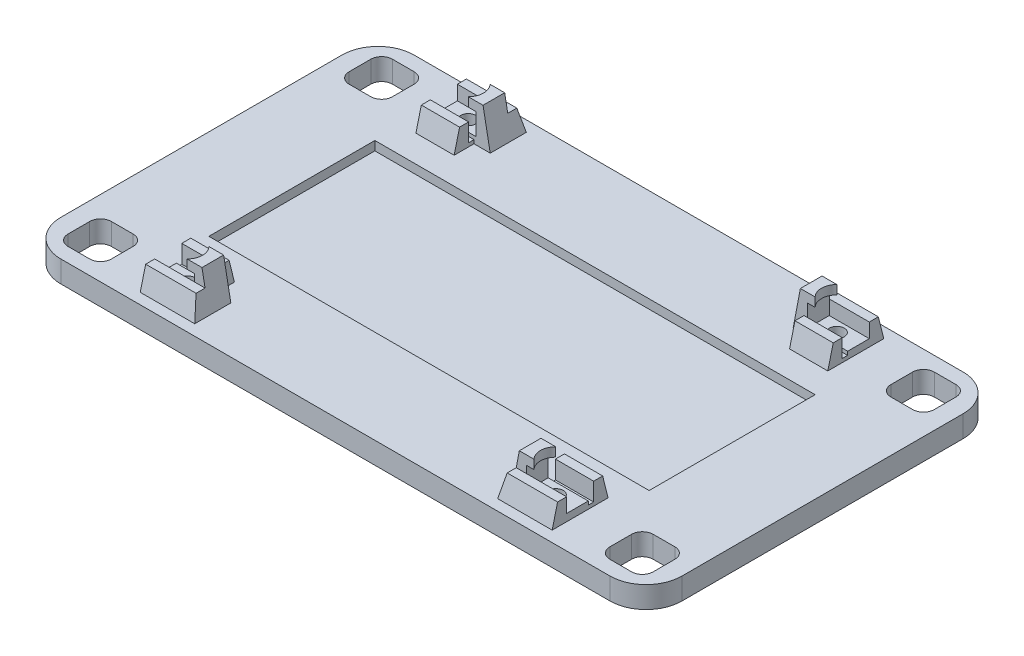
from build123d import *

# Parameters (mm, degrees)
SKETCH1_W                        = 34.5
SKETCH1_H                        = 8.741142107
BOSS_EXTRUDE3_DEPTH              = 6
SKETCH6_W                        = 11
SKETCH6_H                        = 11
BOSS_EXTRUDE4_DEPTH              = 2
CUT_EXTRUDE1_START               = -3
CUT_EXTRUDE1_DEPTH               = 24
SKETCH7_W                        = 11
SKETCH7_H                        = 2.5
SKETCH7_H_2                      = 1
BOSS_EXTRUDE5_DEPTH              = 4
SKETCH10_W                       = 3.083691557
SKETCH10_H                       = 13.597950321
CUT_EXTRUDE2_DEPTH               = 12
SKETCH11_W                       = 10.179154034
SKETCH11_H                       = 1.5
BOSS_EXTRUDE7_DEPTH              = 6
SKETCH12_W                       = 2.5
SKETCH12_H                       = 12.5
BOSS_EXTRUDE8_DEPTH              = 6
BOSS_EXTRUDE9_DEPTH              = 11.6
SKETCH21_R                       = 4.5
CUT_EXTRUDE9_DEPTH               = 3
CUT_EXTRUDE11_DEPTH              = 11.5
BOSS_EXTRUDE14_DEPTH             = 6
CUT_EXTRUDE12_START              = -1
SKETCH28_W                       = 13.111544153
SKETCH28_H                       = 1.5
CUT_EXTRUDE12_DEPTH              = 11
BOSS_EXTRUDE15_DEPTH             = 1.5
SKETCH30_W                       = 2.5
SKETCH30_H                       = 6
BOSS_EXTRUDE16_DEPTH             = 2
SKETCH31_W                       = 2.5
SKETCH31_H                       = 6
BOSS_EXTRUDE17_DEPTH             = 2.5
BOSS_EXTRUDE18_REACH             = 128.051
BOSS_EXTRUDE18_DIRECTION_2_REACH = 128.051
SKETCH34_W                       = 17.603907028
SKETCH34_H                       = 5.411961877
SKETCH34_H_2                     = 6.558600434
CUT_EXTRUDE13_DEPTH              = 4.5
BOSS_EXTRUDE20_DEPTH             = 11.6
MIRROR11_OUTLINE_R               = 2.069860115
MIRROR11_DEPTH                   = 6
MIRROR11_2_OUTLINE_R             = 4.5
MIRROR11_2_OUTLINE_R_2           = 2.069860115
MIRROR11_2_DEPTH                 = 3
MIRROR11_START                   = 6
MIRROR11_3_OUTLINE_R             = 2.069860115
MIRROR11_3_DEPTH                 = 2
MIRROR11_START_2                 = 8
MIRROR11_4_DEPTH                 = 4
MIRROR11_5_OUTLINE_W             = 13.1
MIRROR11_5_OUTLINE_H             = 1.5
MIRROR11_5_DEPTH                 = 1
MIRROR11_START_3                 = 14
MIRROR11_6_DEPTH                 = 2.5
MIRROR11_START_4                 = -59.844904725
MIRROR11_7_OUTLINE_W             = 6
MIRROR11_7_OUTLINE_H             = 2.5
MIRROR11_7_DEPTH                 = 15.1
MIRROR11_START_5                 = -49.244904725
MIRROR11_8_OUTLINE_W             = 10.5
MIRROR11_8_OUTLINE_H             = 6
MIRROR11_8_DEPTH                 = 4.5
MIRROR11_START_6                 = -46.744904725
MIRROR11_9_OUTLINE_W             = 6
MIRROR11_9_OUTLINE_H             = 1.5
MIRROR11_9_DEPTH                 = 2
MIRROR11_10_DEPTH                = 1.5
MIRROR11_START_7                 = -42.831972915
MIRROR11_11_DEPTH                = 2.831972915
BOSS_EXTRUDE21_DEPTH             = 11.6
CUT_EXTRUDE14_START              = -5
SKETCH37_W                       = 89.881860183
SKETCH37_H                       = 1.5
SKETCH37_W_2                     = 87.938782422
CUT_EXTRUDE14_DEPTH              = 5
SKETCH39_W                       = 7.636808492
SKETCH39_H                       = 7.005250269
CUT_EXTRUDE18_DEPTH              = 6
MIRROR13_COPY_1_SKETCH_W         = 7.636808492
MIRROR13_COPY_1_SKETCH_H         = 7.005250269
MIRROR13_COPY_1_DEPTH            = 6
SKETCH41_W                       = 6
SKETCH41_H                       = 6
CUT_EXTRUDE20_DEPTH              = 0.5
SKETCH42_W                       = 122
SKETCH42_H                       = 46
CUT_EXTRUDE21_DEPTH              = 1
SKETCH43_W                       = 24
SKETCH43_H                       = 2
BOSS_EXTRUDE23_DEPTH             = 1
SKETCH44_W                       = 4
SKETCH44_H                       = 17
CUT_EXTRUDE22_DEPTH              = 1.5
SKETCH45_W                       = 16
SKETCH45_H                       = 17
CUT_EXTRUDE23_DEPTH              = 1
SKETCH46_W                       = 58
SKETCH46_H                       = 37
SKETCH46_W_2                     = 54
SKETCH46_H_2                     = 33
BOSS_EXTRUDE25_DEPTH             = 1
SKETCH47_W                       = 54
SKETCH47_H                       = 12
CUT_EXTRUDE24_DEPTH              = 1.5
SKETCH48_W                       = 4
SKETCH48_H                       = 17
CUT_EXTRUDE25_DEPTH              = 1.5
SKETCH49_W                       = 4
SKETCH49_H                       = 17
CUT_EXTRUDE26_DEPTH              = 0.5
SKETCH50_W                       = 4
SKETCH50_H                       = 2
BOSS_EXTRUDE26_DEPTH             = 1
SKETCH_2_W                       = 122
SKETCH_2_H                       = 46
CUT_EXTRUDE_1_DEPTH              = 2.5


with BuildPart() as part:
    # Sketch1 → Boss-Extrude3 (new body)
    # profile 1 of 11: a face of its own
    with BuildSketch(Plane(origin=(0, 0, 0), x_dir=(1, 0, 0), z_dir=(0, 1, 0))):
        with BuildLine():
            Line((73.923306644, 42.779769086), (-59.063365063, 42.779769086))
            ThreePointArc((-59.063365063, 42.779769086), (-65.244285922, 40.219547838), (-67.804507169, 34.03862698))
            Line((-67.804507169, 34.03862698), (-67.804507169, -34.03862698))
            ThreePointArc((-67.804507169, -34.03862698), (-65.244285922, -40.219547838), (-59.063365063, -42.779769086))
            Line((-59.063365063, -42.779769086), (73.923306644, -42.779769086))
            ThreePointArc((73.923306644, -42.779769086), (80.104227503, -40.219547838), (82.664448751, -34.03862698))
            Line((82.664448751, -34.03862698), (82.664448751, 34.03862698))
            ThreePointArc((82.664448751, 34.03862698), (80.104227503, 40.219547838), (73.923306644, 42.779769086))
        make_face()
        with Locations((61.043877697, 34.03862698)):
            Rectangle(SKETCH1_W, SKETCH1_H, mode=Mode.SUBTRACT)
    # profile 2 of 11: a face of its own
    with BuildSketch(Plane(origin=(0, 0, 0), x_dir=(1, 0, 0), z_dir=(0, 1, 0))):
        with BuildLine():
            Line((78.293877697, 29.668055926), (78.293877697, 34.03862698))
            Line((78.293877697, 34.03862698), (74.273170351, 34.03862698))
            ThreePointArc((74.273170351, 34.03862698), (72.293877697, 32.059334326), (70.314585044, 34.03862698))
            Line((70.314585044, 34.03862698), (50.363737812, 34.03862698))
            ThreePointArc((50.363737812, 34.03862698), (48.293877697, 31.968766864), (46.224017582, 34.03862698))
            Line((46.224017582, 34.03862698), (43.793877697, 34.03862698))
            Line((43.793877697, 34.03862698), (43.793877697, 29.668055926))
            Line((43.793877697, 29.668055926), (78.293877697, 29.668055926))
        make_face()
    # profile 3 of 11: a face of its own
    with BuildSketch(Plane(origin=(0, 0, 0), x_dir=(1, 0, 0), z_dir=(0, 1, 0))):
        with BuildLine():
            Line((78.293877697, 34.03862698), (78.293877697, 38.409198033))
            Line((78.293877697, 38.409198033), (43.793877697, 38.409198033))
            Line((43.793877697, 38.409198033), (43.793877697, 34.03862698))
            Line((43.793877697, 34.03862698), (46.224017582, 34.03862698))
            ThreePointArc((46.224017582, 34.03862698), (48.293877697, 36.108487095), (50.363737812, 34.03862698))
            Line((50.363737812, 34.03862698), (70.314585044, 34.03862698))
            ThreePointArc((70.314585044, 34.03862698), (72.293877697, 36.017919633), (74.273170351, 34.03862698))
            Line((74.273170351, 34.03862698), (78.293877697, 34.03862698))
        make_face()
    # profile 4 of 11: a face of its own
    with BuildSketch(Plane(origin=(0, 0, 0), x_dir=(1, 0, 0), z_dir=(0, 1, 0))):
        with BuildLine():
            ThreePointArc((70.314585044, 34.03862698), (72.293877697, 32.059334326), (74.273170351, 34.03862698))
            Line((74.273170351, 34.03862698), (70.314585044, 34.03862698))
        make_face()
    # profile 5 of 11: a face of its own
    with BuildSketch(Plane(origin=(0, 0, 0), x_dir=(1, 0, 0), z_dir=(0, 1, 0))):
        with BuildLine():
            Line((70.314585044, 34.03862698), (74.273170351, 34.03862698))
            ThreePointArc((74.273170351, 34.03862698), (72.293877697, 36.017919633), (70.314585044, 34.03862698))
        make_face()
    # profile 6 of 11: a face of its own
    with BuildSketch(Plane(origin=(0, 0, 0), x_dir=(1, 0, 0), z_dir=(0, 1, 0))):
        with BuildLine():
            ThreePointArc((70.314585044, 34.03862698), (72.293877697, 32.059334326), (74.273170351, 34.03862698))
            Line((74.273170351, 34.03862698), (70.314585044, 34.03862698))
        make_face()
    # profile 7 of 11: a face of its own
    with BuildSketch(Plane(origin=(0, 0, 0), x_dir=(1, 0, 0), z_dir=(0, 1, 0))):
        with BuildLine():
            Line((70.314585044, 34.03862698), (74.273170351, 34.03862698))
            ThreePointArc((74.273170351, 34.03862698), (72.293877697, 36.017919633), (70.314585044, 34.03862698))
        make_face()
    # profile 8 of 11: a face of its own
    with BuildSketch(Plane(origin=(0, 0, 0), x_dir=(1, 0, 0), z_dir=(0, 1, 0))):
        with BuildLine():
            ThreePointArc((50.363737812, 34.03862698), (48.293877697, 36.108487095), (46.224017582, 34.03862698))
            Line((46.224017582, 34.03862698), (50.363737812, 34.03862698))
        make_face()
    # profile 9 of 11: a face of its own
    with BuildSketch(Plane(origin=(0, 0, 0), x_dir=(1, 0, 0), z_dir=(0, 1, 0))):
        with BuildLine():
            Line((50.363737812, 34.03862698), (46.224017582, 34.03862698))
            ThreePointArc((46.224017582, 34.03862698), (48.293877697, 31.968766864), (50.363737812, 34.03862698))
        make_face()
    # profile 10 of 11: a face of its own
    with BuildSketch(Plane(origin=(0, 0, 0), x_dir=(1, 0, 0), z_dir=(0, 1, 0))):
        with BuildLine():
            ThreePointArc((50.363737812, 34.03862698), (48.293877697, 36.108487095), (46.224017582, 34.03862698))
            Line((46.224017582, 34.03862698), (50.363737812, 34.03862698))
        make_face()
    # profile 11 of 11: a face of its own
    with BuildSketch(Plane(origin=(0, 0, 0), x_dir=(1, 0, 0), z_dir=(0, 1, 0))):
        with BuildLine():
            Line((50.363737812, 34.03862698), (46.224017582, 34.03862698))
            ThreePointArc((46.224017582, 34.03862698), (48.293877697, 31.968766864), (50.363737812, 34.03862698))
        make_face()
    extrude(amount=BOSS_EXTRUDE3_DEPTH)

    # Sketch6 → Boss-Extrude4 (add)
    with BuildSketch(Plane(origin=(0, 6, 0), x_dir=(1, 0, 0), z_dir=(0, 1, 0))):
        with Locations((48.114723663, 34.03862698)):
            Rectangle(SKETCH6_W, SKETCH6_H)
    boss_extrude4 = extrude(amount=BOSS_EXTRUDE4_DEPTH)

    # Sketch1<5> → Cut-Extrude1 (cut)
    with BuildSketch(Plane(origin=(0, 0, 0), x_dir=(1, 0, 0), z_dir=(0, 1, 0)).offset(CUT_EXTRUDE1_START)):
        with BuildLine():
            ThreePointArc((50.363737812, 34.03862698), (48.293877697, 36.108487095), (46.224017582, 34.03862698))
            Line((46.224017582, 34.03862698), (50.363737812, 34.03862698))
        make_face()
        with BuildLine():
            Line((50.363737812, 34.03862698), (46.224017582, 34.03862698))
            ThreePointArc((46.224017582, 34.03862698), (48.293877697, 31.968766864), (50.363737812, 34.03862698))
        make_face()
    cut_extrude1 = extrude(amount=CUT_EXTRUDE1_DEPTH, mode=Mode.SUBTRACT)

    # Sketch7 → Boss-Extrude5 (add)
    with BuildSketch(Plane(origin=(0, 8, 0), x_dir=(1, 0, 0), z_dir=(0, 1, 0))):
        with Locations((48.114723663, 38.28862698)):
            Rectangle(SKETCH7_W, SKETCH7_H)
        with Locations((48.114723663, 29.03862698)):
            Rectangle(SKETCH7_W, SKETCH7_H_2)
    boss_extrude5 = extrude(amount=BOSS_EXTRUDE5_DEPTH)

    # Sketch10 → Cut-Extrude2 (cut)
    with BuildSketch(Plane(origin=(0, 6, 0), x_dir=(1, 0, 0), z_dir=(0, 1, 0))):
        with Locations((54.335723476, 34.069991953)):
            Rectangle(SKETCH10_W, SKETCH10_H)
    cut_extrude2 = extrude(amount=CUT_EXTRUDE2_DEPTH, mode=Mode.SUBTRACT)

    # Sketch11 → Boss-Extrude7 (add)
    with BuildSketch(Plane(origin=(0, 6, 0), x_dir=(1, 0, 0), z_dir=(0, 1, 0))):
        with Locations((47.70430068, 27.78862698)):
            Rectangle(SKETCH11_W, SKETCH11_H)
    boss_extrude7 = extrude(amount=BOSS_EXTRUDE7_DEPTH)

    # Sketch12 → Boss-Extrude8 (add)
    with BuildSketch(Plane(origin=(0, 6, 0), x_dir=(1, 0, 0), z_dir=(0, 1, 0))):
        with Locations((42.443877697, 33.28862698)):
            Rectangle(SKETCH12_W, SKETCH12_H)
    boss_extrude8 = extrude(amount=BOSS_EXTRUDE8_DEPTH)

    # Sketch13 → Boss-Extrude9 (add)
    with BuildSketch(Plane.ZY.offset(-41.193877697)):
        Polygon((-27.03862698, 12), (-27.03862698, 6), (-25.53862698, 6), align=None)
        Polygon((-39.53862698, 12), (-39.53862698, 6), (-41.03862698, 6), align=None)
    extrude(amount=-BOSS_EXTRUDE9_DEPTH)

    # Sketch21 → Cut-Extrude9 (cut)
    with BuildSketch(Plane.XZ):
        with Locations(Location((48.293877697, -34.03862698, 0), (0, 0, 270))):
            Circle(SKETCH21_R)
    cut_extrude9 = extrude(amount=-CUT_EXTRUDE9_DEPTH, mode=Mode.SUBTRACT)

    # Sketch24 → Cut-Extrude11 (cut)
    with BuildSketch(Plane(origin=(0, 6, 0), x_dir=(1, 0, 0), z_dir=(0, 1, 0))):
        with BuildLine():
            Line((69.293877697, 40.03862698), (75.293877697, 40.03862698))
            ThreePointArc((75.293877697, 40.03862698), (77.415198041, 39.159947323), (78.293877697, 37.03862698))
            Line((78.293877697, 37.03862698), (78.293877697, 31.03862698))
            ThreePointArc((78.293877697, 31.03862698), (77.415198041, 28.917306636), (75.293877697, 28.03862698))
            Line((75.293877697, 28.03862698), (69.293877697, 28.03862698))
            ThreePointArc((69.293877697, 28.03862698), (67.172557354, 28.917306636), (66.293877697, 31.03862698))
            Line((66.293877697, 31.03862698), (66.293877697, 37.03862698))
            ThreePointArc((66.293877697, 37.03862698), (67.172557354, 39.159947323), (69.293877697, 40.03862698))
        make_face()
    cut_extrude11 = extrude(amount=-CUT_EXTRUDE11_DEPTH, mode=Mode.SUBTRACT)

    # Sketch26 → Boss-Extrude14 (add)
    with BuildSketch(Plane.XZ):
        with BuildLine():
            Line((-78.844904725, 53.842790723), (73.293877697, 53.842790723))
            ThreePointArc((73.293877697, 53.842790723), (80.364945509, 50.913858534), (83.293877697, 43.842790723))
            Line((83.293877697, 43.842790723), (83.293877697, -34.03862698))
            ThreePointArc((83.293877697, -34.03862698), (80.364945509, -41.109694791), (73.293877697, -44.03862698))
            Line((73.293877697, -44.03862698), (-78.844904725, -44.03862698))
            ThreePointArc((-78.844904725, -44.03862698), (-85.915972537, -41.109694791), (-88.844904725, -34.03862698))
            Line((-88.844904725, -34.03862698), (-88.844904725, 43.842790723))
            ThreePointArc((-88.844904725, 43.842790723), (-85.915972537, 50.913858534), (-78.844904725, 53.842790723))
        make_face()
        Polygon((39.621658068, -22.50744652), (81.471959084, -23.594467326), (79.917902441, -39.014138958), (77.090986998, -41.323408937), (59.598365076, -40.869055121), (39.621658068, -40.350179614), align=None, mode=Mode.SUBTRACT)
    extrude(amount=-BOSS_EXTRUDE14_DEPTH)

    # Sketch28 → Cut-Extrude12 (cut)
    with BuildSketch(Plane(origin=(0, 8, 0), x_dir=(1, 0, 0), z_dir=(0, 1, 0)).offset(CUT_EXTRUDE12_START)):
        with Locations((46.238105621, 30.28862698)):
            Rectangle(SKETCH28_W, SKETCH28_H)
    cut_extrude12 = extrude(amount=CUT_EXTRUDE12_DEPTH, mode=Mode.SUBTRACT)

    # Sketch29 → Boss-Extrude15 (add)
    with BuildSketch(Plane(origin=(52.793877697, 0, 0), x_dir=(0, 0, -1), z_dir=(1, 0, 0))):
        Polygon((37.03862698, 8), (31.03862698, 8), (31.03862698, 7), (29.53862698, 7), (29.53862698, 12), (27.03862698, 12), (25.53862698, 6), (41.03862698, 6), (39.53862698, 12), (37.03862698, 12), align=None)
    boss_extrude15 = extrude(amount=BOSS_EXTRUDE15_DEPTH)

    # Sketch30 → Boss-Extrude16 (add)
    with BuildSketch(Plane(origin=(0, 12, 0), x_dir=(1, 0, 0), z_dir=(0, 1, 0))):
        with Locations((42.443877697, 34.03862698)):
            Rectangle(SKETCH30_W, SKETCH30_H)
    boss_extrude16 = extrude(amount=BOSS_EXTRUDE16_DEPTH)

    # Sketch31 → Boss-Extrude17 (add)
    with BuildSketch(Plane(origin=(0, 14, 0), x_dir=(1, 0, 0), z_dir=(0, 1, 0))):
        with Locations((42.443877697, 34.03862698)):
            Rectangle(SKETCH31_W, SKETCH31_H)
        with BuildLine():
            Line((45.283479053, 37.03862698), (43.693877697, 37.03862698))
            Line((43.693877697, 37.03862698), (43.693877697, 31.03862698))
            Line((43.693877697, 31.03862698), (45.283479053, 31.03862698))
            ThreePointArc((45.283479053, 31.03862698), (44.043877697, 34.03862698), (45.283479053, 37.03862698))
        make_face()
    boss_extrude17 = extrude(amount=BOSS_EXTRUDE17_DEPTH)

    # Boss-Extrude18: up to this plane
    boss_extrude18_end = Plane(origin=(58.978536136, 6, -25.53862698), z_dir=(0, 0.2425356250363332, 0.9701425001453319))
    # Sketch33 → Boss-Extrude18 (add, up to the surface)
    with BuildSketch(Plane.XY.offset(-34.03862698), mode=Mode.PRIVATE) as boss_extrude18_sk1:
        Polygon((41.193877697, 16.5), (39.193877697, 6), (41.193877697, 6), align=None)
    boss_extrude18_tool1 = split(extrude(boss_extrude18_sk1.sketch, amount=BOSS_EXTRUDE18_REACH, mode=Mode.PRIVATE), bisect_by=boss_extrude18_end, keep=Keep.BOTH, mode=Mode.PRIVATE)
    boss_extrude18 = boss_extrude18_tool1.solids().sort_by_distance((40.527211, 9.5, -34.038627))[0]
    add(boss_extrude18)

    # Boss-Extrude18 direction 2: up to this plane
    boss_extrude18_direction_2_end = Plane(origin=(58.978536136, 6, -41.03862698), z_dir=(0, 0.2425356250363332, -0.9701425001453319))
    # Sketch33 → Boss-Extrude18 direction 2 (add, up to the surface)
    with BuildSketch(Plane.XY.offset(-34.03862698), mode=Mode.PRIVATE) as boss_extrude18_direction_2_sk1:
        Polygon((41.193877697, 16.5), (39.193877697, 6), (41.193877697, 6), align=None)
    boss_extrude18_direction_2_tool1 = split(extrude(boss_extrude18_direction_2_sk1.sketch, amount=-BOSS_EXTRUDE18_DIRECTION_2_REACH, mode=Mode.PRIVATE), bisect_by=boss_extrude18_direction_2_end, keep=Keep.BOTH, mode=Mode.PRIVATE)
    boss_extrude18_direction_2 = boss_extrude18_direction_2_tool1.solids().sort_by_distance((40.527211, 9.5, -34.038627))[0]
    add(boss_extrude18_direction_2)
    boss_extrude18 = boss_extrude18 + boss_extrude18_direction_2  # both directions under the feature's name, for the pattern or mirror that repeats it

    # Sketch34 → Cut-Extrude13 (cut)
    with BuildSketch(Plane(origin=(0, 16.5, 0), x_dir=(1, 0, 0), z_dir=(0, 1, 0))):
        with Locations((45.491924183, 39.744607919)):
            Rectangle(SKETCH34_W, SKETCH34_H)
        with Locations((45.491924183, 27.759326763)):
            Rectangle(SKETCH34_W, SKETCH34_H_2)
    cut_extrude13 = extrude(amount=-CUT_EXTRUDE13_DEPTH, mode=Mode.SUBTRACT)

    # Mirror9: Boss-Extrude4, Cut-Extrude1, Boss-Extrude5, Cut-Extrude2, Boss-Extrude7, Boss-Extrude8, Cut-Extrude9, Cut-Extrude11, Cut-Extrude12, Boss-Extrude15, Boss-Extrude16, Boss-Extrude17, Boss-Extrude18, Cut-Extrude13 across plane
    add(boss_extrude4.mirror(Plane.XY.offset(4.902081871)))
    add(cut_extrude1.mirror(Plane.XY.offset(4.902081871)), mode=Mode.SUBTRACT)
    add(boss_extrude5.mirror(Plane.XY.offset(4.902081871)))
    add(cut_extrude2.mirror(Plane.XY.offset(4.902081871)), mode=Mode.SUBTRACT)
    add(boss_extrude7.mirror(Plane.XY.offset(4.902081871)))
    add(boss_extrude8.mirror(Plane.XY.offset(4.902081871)))
    add(cut_extrude9.mirror(Plane.XY.offset(4.902081871)), mode=Mode.SUBTRACT)
    add(cut_extrude11.mirror(Plane.XY.offset(4.902081871)), mode=Mode.SUBTRACT)
    add(cut_extrude12.mirror(Plane.XY.offset(4.902081871)), mode=Mode.SUBTRACT)
    add(boss_extrude15.mirror(Plane.XY.offset(4.902081871)))
    add(boss_extrude16.mirror(Plane.XY.offset(4.902081871)))
    add(boss_extrude17.mirror(Plane.XY.offset(4.902081871)))
    add(boss_extrude18.mirror(Plane.XY.offset(4.902081871)))
    add(cut_extrude13.mirror(Plane.XY.offset(4.902081871)), mode=Mode.SUBTRACT)

    # Sketch35 → Boss-Extrude20 (add)
    with BuildSketch(Plane.ZY.offset(-52.793877697)):
        Polygon((35.342790723, 6), (36.842790723, 6), (36.842790723, 12), align=None)
        Polygon((50.842790723, 6), (49.342790723, 12), (49.342790723, 6), align=None)
    extrude(amount=BOSS_EXTRUDE20_DEPTH)

    # Mirror11: read off the stored shape, not the designer's step
    # Mirror11 outline → Mirror11 (cut)
    with BuildSketch(Plane(origin=(0, 0, 0), x_dir=(1, 0, 0), z_dir=(0, 1, 0))):
        with Locations((-53.844904725, 34.03862698)):
            Circle(MIRROR11_OUTLINE_R)
        with Locations((-53.844904725, -43.842790723)):
            Circle(MIRROR11_OUTLINE_R)
        with BuildLine():
            Line((-74.844904725, 40.03862698), (-80.844904725, 40.03862698))
            ThreePointArc((-80.844904725, 40.03862698), (-82.966225069, 39.159947323), (-83.844904725, 37.03862698))
            Line((-83.844904725, 37.03862698), (-83.844904725, 31.03862698))
            ThreePointArc((-83.844904725, 31.03862698), (-82.966225069, 28.917306636), (-80.844904725, 28.03862698))
            Line((-80.844904725, 28.03862698), (-74.844904725, 28.03862698))
            ThreePointArc((-74.844904725, 28.03862698), (-72.723584382, 28.917306636), (-71.844904725, 31.03862698))
            Line((-71.844904725, 31.03862698), (-71.844904725, 37.03862698))
            ThreePointArc((-71.844904725, 37.03862698), (-72.723584382, 39.159947323), (-74.844904725, 40.03862698))
        make_face()
        with BuildLine():
            ThreePointArc((-71.844904725, -40.842790723), (-72.723584382, -38.721470379), (-74.844904725, -37.842790723))
            Line((-74.844904725, -37.842790723), (-80.844904725, -37.842790723))
            ThreePointArc((-80.844904725, -37.842790723), (-82.966225069, -38.721470379), (-83.844904725, -40.842790723))
            Line((-83.844904725, -40.842790723), (-83.844904725, -46.842790723))
            ThreePointArc((-83.844904725, -46.842790723), (-82.966225069, -48.964111066), (-80.844904725, -49.842790723))
            Line((-80.844904725, -49.842790723), (-74.844904725, -49.842790723))
            ThreePointArc((-74.844904725, -49.842790723), (-72.723584382, -48.964111066), (-71.844904725, -46.842790723))
            Line((-71.844904725, -46.842790723), (-71.844904725, -40.842790723))
        make_face()
    extrude(amount=MIRROR11_DEPTH, mode=Mode.SUBTRACT)

    # Mirror11 2 outline → Mirror11 2 (cut)
    # profile 1 of 2: a face of its own
    with BuildSketch(Plane(origin=(0, 0, 0), x_dir=(1, 0, 0), z_dir=(0, 1, 0))):
        with Locations((-53.844904725, -43.842790723)):
            Circle(MIRROR11_2_OUTLINE_R)
        with Locations((-53.844904725, -43.842790723)):
            Circle(MIRROR11_2_OUTLINE_R_2, mode=Mode.SUBTRACT)
    # profile 2 of 2: a face of its own
    with BuildSketch(Plane(origin=(0, 0, 0), x_dir=(1, 0, 0), z_dir=(0, 1, 0))):
        with Locations((-53.844904725, 34.03862698)):
            Circle(MIRROR11_2_OUTLINE_R)
        with Locations((-53.844904725, 34.03862698)):
            Circle(MIRROR11_2_OUTLINE_R_2, mode=Mode.SUBTRACT)
    extrude(amount=MIRROR11_2_DEPTH, mode=Mode.SUBTRACT)

    # Mirror11 3 outline → Mirror11 3 (add)
    # profile 1 of 2: a face of its own
    with BuildSketch(Plane(origin=(0, 0, 0), x_dir=(1, 0, 0), z_dir=(0, 1, 0)).offset(MIRROR11_START)):
        with BuildLine():
            Line((-50.490802759, -46.842790723), (-49.244904725, -46.842790723))
            Line((-49.244904725, -46.842790723), (-49.244904725, -40.842790723))
            Line((-49.244904725, -40.842790723), (-59.844904725, -40.842790723))
            Line((-59.844904725, -40.842790723), (-59.844904725, -46.842790723))
            Line((-59.844904725, -46.842790723), (-57.199006691, -46.842790723))
            ThreePointArc((-57.199006691, -46.842790723), (-53.844904725, -48.342790723), (-50.490802759, -46.842790723))
        make_face()
        with Locations((-53.844904725, -43.842790723)):
            Circle(MIRROR11_3_OUTLINE_R, mode=Mode.SUBTRACT)
    # profile 2 of 2: a face of its own
    with BuildSketch(Plane(origin=(0, 0, 0), x_dir=(1, 0, 0), z_dir=(0, 1, 0)).offset(MIRROR11_START)):
        with BuildLine():
            Line((-49.244904725, 31.03862698), (-49.244904725, 37.03862698))
            Line((-49.244904725, 37.03862698), (-50.490802759, 37.03862698))
            ThreePointArc((-50.490802759, 37.03862698), (-53.844904725, 38.53862698), (-57.199006691, 37.03862698))
            Line((-57.199006691, 37.03862698), (-59.844904725, 37.03862698))
            Line((-59.844904725, 37.03862698), (-59.844904725, 31.03862698))
            Line((-59.844904725, 31.03862698), (-49.244904725, 31.03862698))
        make_face()
        with Locations((-53.844904725, 34.03862698)):
            Circle(MIRROR11_3_OUTLINE_R, mode=Mode.SUBTRACT)
    extrude(amount=MIRROR11_3_DEPTH)

    # Mirror11 4 outline → Mirror11 4 (add)
    with BuildSketch(Plane(origin=(0, 0, 0), x_dir=(1, 0, 0), z_dir=(0, 1, 0)).offset(MIRROR11_START_2)):
        with BuildLine():
            ThreePointArc((-57.199006691, -46.842790723), (-53.844904725, -48.342790723), (-50.490802759, -46.842790723))
            Line((-50.490802759, -46.842790723), (-57.199006691, -46.842790723))
        make_face()
        with BuildLine():
            Line((-57.199006691, 37.03862698), (-50.490802759, 37.03862698))
            ThreePointArc((-50.490802759, 37.03862698), (-53.844904725, 38.53862698), (-57.199006691, 37.03862698))
        make_face()
    extrude(amount=MIRROR11_4_DEPTH)

    # Mirror11 5 outline → Mirror11 5 (add)
    with BuildSketch(Plane(origin=(0, 0, 0), x_dir=(1, 0, 0), z_dir=(0, 1, 0)).offset(MIRROR11_START)):
        with Locations((-53.294904725, -40.092790723)):
            Rectangle(MIRROR11_5_OUTLINE_W, MIRROR11_5_OUTLINE_H)
        with Locations((-53.294904725, 30.28862698)):
            Rectangle(MIRROR11_5_OUTLINE_W, MIRROR11_5_OUTLINE_H)
    extrude(amount=MIRROR11_5_DEPTH)

    # Mirror11 7 outline → Mirror11 7 (add)
    with BuildSketch(Plane.YZ.offset(MIRROR11_START_4)):
        Polygon((6, 39.342790723), (6, 35.342790723), (12, 36.842790723), (12, 39.342790723), align=None)
        with Locations((9, -28.28862698)):
            Rectangle(MIRROR11_7_OUTLINE_W, MIRROR11_7_OUTLINE_H)
        with Locations((9, -38.28862698)):
            Rectangle(MIRROR11_7_OUTLINE_W, MIRROR11_7_OUTLINE_H)
        Polygon((6, 50.842790723), (6, 46.842790723), (12, 46.842790723), (12, 49.342790723), align=None)
    extrude(amount=MIRROR11_7_DEPTH)



with BuildPart() as body_2:
    # Mirror11 6 outline → Mirror11 6 (new body)
    with BuildSketch(Plane(origin=(0, 0, 0), x_dir=(1, 0, 0), z_dir=(0, 1, 0)).offset(MIRROR11_START_3)):
        with BuildLine():
            Line((-49.244904725, -46.842790723), (-49.244904725, -40.842790723))
            Line((-49.244904725, -40.842790723), (-50.834506081, -40.842790723))
            ThreePointArc((-50.834506081, -40.842790723), (-49.594904725, -43.842790723), (-50.834506081, -46.842790723))
            Line((-50.834506081, -46.842790723), (-49.244904725, -46.842790723))
        make_face()
        with BuildLine():
            Line((-49.244904725, 31.03862698), (-49.244904725, 37.03862698))
            Line((-49.244904725, 37.03862698), (-50.834506081, 37.03862698))
            ThreePointArc((-50.834506081, 37.03862698), (-49.594904725, 34.03862698), (-50.834506081, 31.03862698))
            Line((-50.834506081, 31.03862698), (-49.244904725, 31.03862698))
        make_face()
    extrude(amount=MIRROR11_6_DEPTH)


with BuildPart() as part_1:
    add(part.part)

    add(body_2.part)  # Mirror11 8 merges body 2
    # Mirror11 8 outline → Mirror11 8 (add)
    with BuildSketch(Plane.YZ.offset(MIRROR11_START_5)):
        with Locations((11.25, -34.03862698)):
            Rectangle(MIRROR11_8_OUTLINE_W, MIRROR11_8_OUTLINE_H)
        with Locations((11.25, 43.842790723)):
            Rectangle(MIRROR11_8_OUTLINE_W, MIRROR11_8_OUTLINE_H)
    extrude(amount=MIRROR11_8_DEPTH)

    # Mirror11 9 outline → Mirror11 9 (add)
    with BuildSketch(Plane.YZ.offset(MIRROR11_START_6)):
        with Locations((9, -30.28862698)):
            Rectangle(MIRROR11_9_OUTLINE_W, MIRROR11_9_OUTLINE_H)
        Polygon((6, -27.03862698), (12, -27.03862698), (6, -25.53862698), align=None)
        with Locations((9, 40.092790723)):
            Rectangle(MIRROR11_9_OUTLINE_W, MIRROR11_9_OUTLINE_H)
        Polygon((12, -39.53862698), (6, -39.53862698), (6, -41.03862698), align=None)
    extrude(amount=MIRROR11_9_DEPTH)

    # Mirror11 10 outline → Mirror11 10 (add)
    with BuildSketch(Plane.YZ.offset(MIRROR11_START_4)):
        Polygon((6, -27.03862698), (12, -27.03862698), (6, -25.53862698), align=None)
        Polygon((12, -39.53862698), (6, -39.53862698), (6, -41.03862698), align=None)
    extrude(amount=MIRROR11_10_DEPTH)

    # Mirror11 11 outline → Mirror11 11 (cut)
    with BuildSketch(Plane(origin=(0, 0, 0), x_dir=(-0.18711210788999502, 0.9823385664224749, 0), z_dir=(0.9823385664224749, 0.187112107889995, 0)).offset(MIRROR11_START_7)):
        Polygon((14.266344839, -41.03862698), (20.374218647, -39.53862698), (20.374218647, -37.03862698), (24.955124002, -37.03862698), (24.955124002, -31.03862698), (20.374218647, -31.03862698), (20.374218647, -27.03862698), (14.266344839, -25.53862698), align=None)
        Polygon((24.955124002, 40.842790723), (24.955124002, 46.842790723), (20.374218647, 46.842790723), (20.374218647, 49.342790723), (14.266344839, 50.842790723), (14.266344839, 35.342790723), (20.374218647, 36.842790723), (20.374218647, 40.842790723), align=None)
    extrude(amount=MIRROR11_11_DEPTH, mode=Mode.SUBTRACT)

    # Sketch36 → Boss-Extrude21 (add)
    with BuildSketch(Plane(origin=(-58.344904725, 0, 0), x_dir=(0, 0, -1), z_dir=(1, 0, 0))):
        Polygon((41.03862698, 6), (39.53862698, 12), (39.53862698, 6), align=None)
        Polygon((25.53862698, 6), (27.03862698, 6), (27.03862698, 12), align=None)
    extrude(amount=BOSS_EXTRUDE21_DEPTH)

    # Sketch37 → Cut-Extrude14 (cut)
    with BuildSketch(Plane(origin=(0, 12, 0), x_dir=(1, 0, 0), z_dir=(0, 1, 0)).offset(CUT_EXTRUDE14_START)):
        with Locations((-3.747052394, -40.092790723)):
            Rectangle(SKETCH37_W, SKETCH37_H)
        with Locations((-2.775513514, 30.28862698)):
            Rectangle(SKETCH37_W_2, SKETCH37_H)
    extrude(amount=CUT_EXTRUDE14_DEPTH, mode=Mode.SUBTRACT)

    # Sketch39 → Cut-Extrude18 (cut)
    with BuildSketch(Plane(origin=(0, 12, 0), x_dir=(1, 0, 0), z_dir=(0, 1, 0))):
        with Locations((-45.426500479, -37.340165588)):
            Rectangle(SKETCH39_W, SKETCH39_H)
    cut_extrude18 = extrude(amount=-CUT_EXTRUDE18_DEPTH, mode=Mode.SUBTRACT)

    # Mirror12: Cut-Extrude18 across plane
    add(cut_extrude18.mirror(Plane.XY.offset(4.902081871)), mode=Mode.SUBTRACT)

    # Mirror13: Cut-Extrude18 across plane
    add(cut_extrude18.mirror(Plane.ZY.offset(2.775513514)), mode=Mode.SUBTRACT)

    # Mirror13 copy 1 sketch → Mirror13 copy 1 (cut)
    with BuildSketch(Plane(origin=(-5.551027028, 12, 9.804163743), x_dir=(-1, 0, 0), z_dir=(0, 1, 0))):
        with Locations((-45.426500479, -37.340165588)):
            Rectangle(MIRROR13_COPY_1_SKETCH_W, MIRROR13_COPY_1_SKETCH_H)
    extrude(amount=-MIRROR13_COPY_1_DEPTH, mode=Mode.SUBTRACT)

    # Sketch41 → Cut-Extrude20 (cut)
    with BuildSketch(Plane(origin=(43.693877697, 0, 0), x_dir=(0, 0, -1), z_dir=(1, 0, 0))):
        with Locations((34.03862698, 11)):
            Rectangle(SKETCH41_W, SKETCH41_H)
        with Locations((-43.842790723, 11)):
            Rectangle(SKETCH41_W, SKETCH41_H)
    cut_extrude20 = extrude(amount=-CUT_EXTRUDE20_DEPTH, mode=Mode.SUBTRACT)

    # Mirror14: Cut-Extrude20 across plane
    add(cut_extrude20.mirror(Plane.ZY.offset(2.775513514)), mode=Mode.SUBTRACT)

    # Sketch42 → Cut-Extrude21 (cut)
    with BuildSketch(Plane(origin=(0, 6, 0), x_dir=(1, 0, 0), z_dir=(0, 1, 0))):
        with Locations((-2.775513514, -4.902081871)):
            Rectangle(SKETCH42_W, SKETCH42_H)
    extrude(amount=-CUT_EXTRUDE21_DEPTH, mode=Mode.SUBTRACT)

    # Sketch43 → Boss-Extrude23 (add)
    with BuildSketch(Plane(origin=(0, 5, 0), x_dir=(1, 0, 0), z_dir=(0, 1, 0))):
        with Locations((-51.775513514, -9.902081871)):
            Rectangle(SKETCH43_W, SKETCH43_H)
        with Locations((-51.775513514, 0.097918129)):
            Rectangle(SKETCH43_W, SKETCH43_H)
        with Locations((46.224486486, 0.097918129)):
            Rectangle(SKETCH43_W, SKETCH43_H)
        with Locations((46.224486486, -9.902081871)):
            Rectangle(SKETCH43_W, SKETCH43_H)
    extrude(amount=BOSS_EXTRUDE23_DEPTH)

    # Sketch44 → Cut-Extrude22 (cut)
    with BuildSketch(Plane(origin=(0, 5, 0), x_dir=(1, 0, 0), z_dir=(0, 1, 0))):
        with Locations((-61.775513514, -19.402081871)):
            Rectangle(SKETCH44_W, SKETCH44_H)
        with Locations((-41.775513514, -19.402081871)):
            Rectangle(SKETCH44_W, SKETCH44_H)
        with Locations((-61.775513514, 9.597918129)):
            Rectangle(SKETCH44_W, SKETCH44_H)
        with Locations((-41.775513514, 9.597918129)):
            Rectangle(SKETCH44_W, SKETCH44_H)
        with Locations((36.224486486, 9.597918129)):
            Rectangle(SKETCH44_W, SKETCH44_H)
        with Locations((56.224486486, 9.597918129)):
            Rectangle(SKETCH44_W, SKETCH44_H)
        with Locations((36.224486486, -19.402081871)):
            Rectangle(SKETCH44_W, SKETCH44_H)
        with Locations((56.224486486, -19.402081871)):
            Rectangle(SKETCH44_W, SKETCH44_H)
    extrude(amount=-CUT_EXTRUDE22_DEPTH, mode=Mode.SUBTRACT)

    # Sketch45 → Cut-Extrude23 (cut)
    with BuildSketch(Plane(origin=(0, 5, 0), x_dir=(1, 0, 0), z_dir=(0, 1, 0))):
        with Locations((-51.775513514, 9.597918129)):
            Rectangle(SKETCH45_W, SKETCH45_H)
        with Locations((-51.775513514, -19.402081871)):
            Rectangle(SKETCH45_W, SKETCH45_H)
        with Locations((46.224486486, 9.597918129)):
            Rectangle(SKETCH45_W, SKETCH45_H)
        with Locations((46.224486486, -19.402081871)):
            Rectangle(SKETCH45_W, SKETCH45_H)
    extrude(amount=-CUT_EXTRUDE23_DEPTH, mode=Mode.SUBTRACT)

    # Sketch46 → Boss-Extrude25 (add)
    with BuildSketch(Plane(origin=(0, 5, 0), x_dir=(1, 0, 0), z_dir=(0, 1, 0))):
        with Locations((-2.775513514, -4.902081871)):
            Rectangle(SKETCH46_W, SKETCH46_H)
        with Locations((-2.775513514, -4.902081871)):
            Rectangle(SKETCH46_W_2, SKETCH46_H_2, mode=Mode.SUBTRACT)
    extrude(amount=BOSS_EXTRUDE25_DEPTH)

    # Sketch47 → Cut-Extrude24 (cut)
    with BuildSketch(Plane(origin=(0, 5, 0), x_dir=(1, 0, 0), z_dir=(0, 1, 0))):
        with Locations((-2.775513514, 5.597918129)):
            Rectangle(SKETCH47_W, SKETCH47_H)
        with Locations((-2.775513514, -15.402081871)):
            Rectangle(SKETCH47_W, SKETCH47_H)
    extrude(amount=-CUT_EXTRUDE24_DEPTH, mode=Mode.SUBTRACT)

    # Sketch48 → Cut-Extrude25 (cut)
    with BuildSketch(Plane(origin=(0, 5, 0), x_dir=(1, 0, 0), z_dir=(0, 1, 0))):
        with Locations((-37.775513514, 9.597918129)):
            Rectangle(SKETCH48_W, SKETCH48_H)
        with Locations((-37.775513514, -19.402081871)):
            Rectangle(SKETCH48_W, SKETCH48_H)
        with Locations((32.224486486, 9.597918129)):
            Rectangle(SKETCH48_W, SKETCH48_H)
        with Locations((32.224486486, -19.402081871)):
            Rectangle(SKETCH48_W, SKETCH48_H)
    extrude(amount=-CUT_EXTRUDE25_DEPTH, mode=Mode.SUBTRACT)

    # Sketch49 → Cut-Extrude26 (cut)
    with BuildSketch(Plane(origin=(0, 4, 0), x_dir=(1, 0, 0), z_dir=(0, 1, 0))):
        with Locations((-57.775513514, 9.597918129)):
            Rectangle(SKETCH49_W, SKETCH49_H)
        with Locations((-57.775513514, -19.402081871)):
            Rectangle(SKETCH49_W, SKETCH49_H)
        with Locations((52.224486486, 9.597918129)):
            Rectangle(SKETCH49_W, SKETCH49_H)
        with Locations((52.224486486, -19.402081871)):
            Rectangle(SKETCH49_W, SKETCH49_H)
    extrude(amount=-CUT_EXTRUDE26_DEPTH, mode=Mode.SUBTRACT)

    # Sketch50 → Boss-Extrude26 (add)
    with BuildSketch(Plane(origin=(0, 5, 0), x_dir=(1, 0, 0), z_dir=(0, 1, 0))):
        with Locations((-37.775513514, 0.097918129)):
            Rectangle(SKETCH50_W, SKETCH50_H)
        with Locations((-37.775513514, -9.902081871)):
            Rectangle(SKETCH50_W, SKETCH50_H)
        with Locations((32.224486486, 0.097918129)):
            Rectangle(SKETCH50_W, SKETCH50_H)
        with Locations((32.224486486, -9.902081871)):
            Rectangle(SKETCH50_W, SKETCH50_H)
    extrude(amount=BOSS_EXTRUDE26_DEPTH)

    # 草图2 → 切除-拉伸1 (cut)
    with BuildSketch(Plane(origin=(0, 6, 0), x_dir=(1, 0, 0), z_dir=(0, 1, 0))):
        with Locations((-2.775513514, -4.902081871)):
            Rectangle(SKETCH_2_W, SKETCH_2_H)
    extrude(amount=-CUT_EXTRUDE_1_DEPTH, mode=Mode.SUBTRACT)


solid = part_1.part
